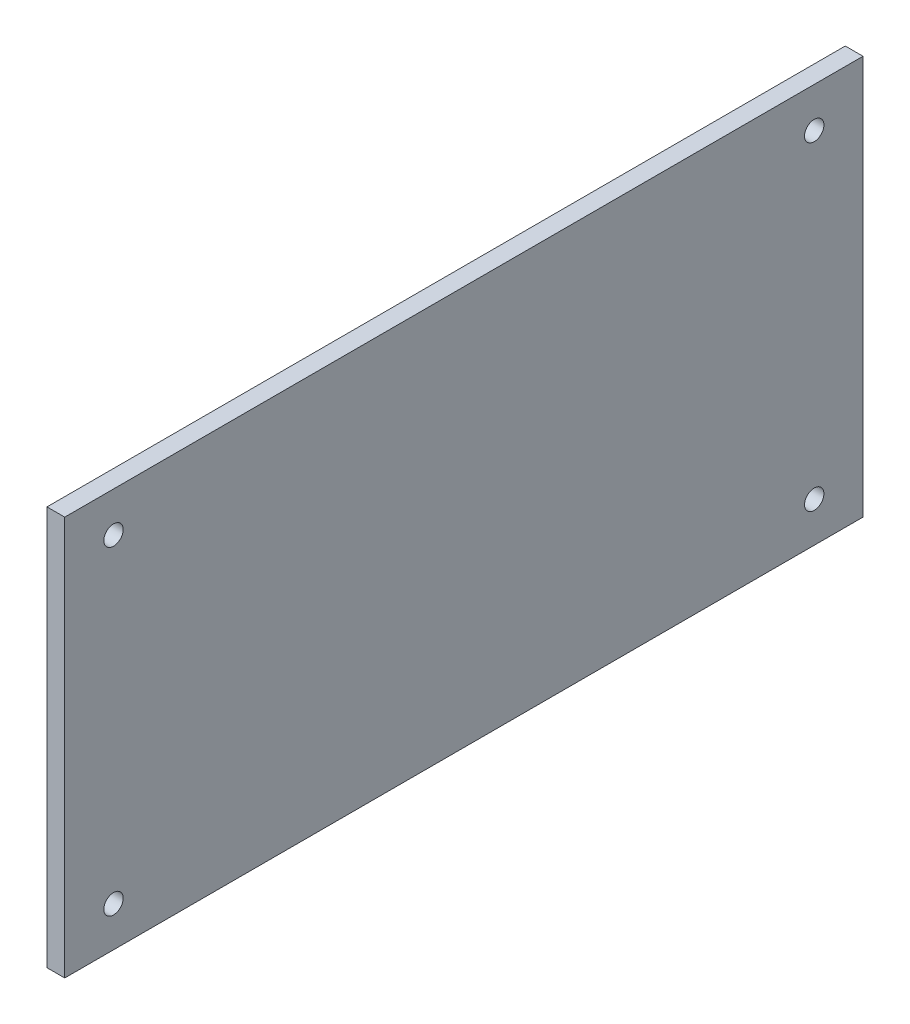
from build123d import *

# Parameters (mm, degrees)
SKETCH1_W           = 90
SKETCH1_H           = 45
BOSS_EXTRUDE1_DEPTH = 2
SKETCH2_R           = 1.0922
CUT_EXTRUDE1_DEPTH  = 10


with BuildPart() as part:
    # Sketch1 → Boss-Extrude1 (new body)
    with BuildSketch(Plane(origin=(0, 0, 0), x_dir=(0, 0, -1), z_dir=(1, 0, 0))):
        Rectangle(SKETCH1_W, SKETCH1_H)
    extrude(amount=BOSS_EXTRUDE1_DEPTH)

    # Sketch2 → Cut-Extrude1 (cut)
    with BuildSketch(Plane(origin=(2, 0, 0), x_dir=(0, 0, -1), z_dir=(1, 0, 0))):
        with Locations((-39.5, -18)):
            Circle(SKETCH2_R)
        with Locations((39.5, -18)):
            Circle(SKETCH2_R)
        with Locations((39.5, 18)):
            Circle(SKETCH2_R)
        with Locations((-39.5, 18)):
            Circle(SKETCH2_R)
    extrude(amount=-CUT_EXTRUDE1_DEPTH, mode=Mode.SUBTRACT)


solid = part.part
